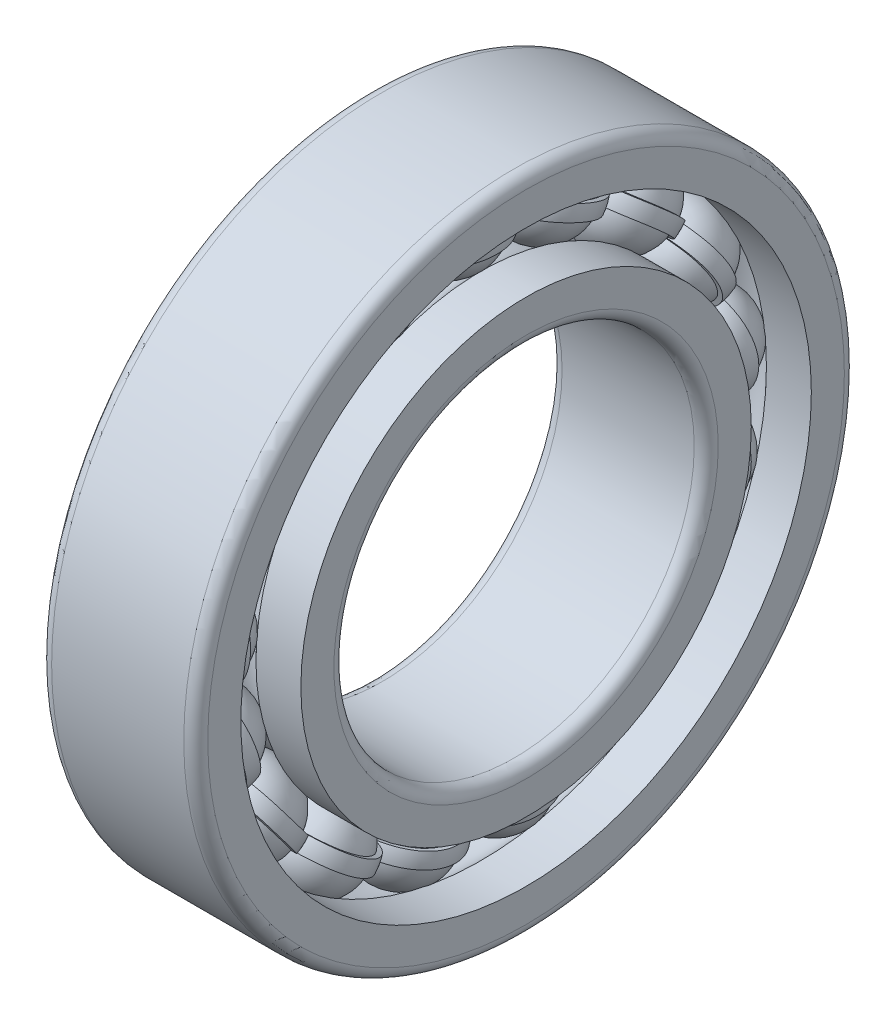
from build123d import *

# Parameters (mm, degrees)
CAGSPISKE_W          = 0.75
CAGSPISKE_H          = 1.25
CAGEBALLS_COUNT      = 17
CAGEBALLS_ANGLE      = 338.823529412
CAGTRMODSKE_W        = 8.252
CAGTRMODSKE_H        = 3.501
CAGETRIMID_START     = -4.077376728
CAGETRIMID_OUTLINE_R = 20.625
CAGETRIMID_DEPTH     = 8.154753456
CIRPATTERN4_COUNT    = 17


with BuildPart() as part:
    # CagSpiSke → CageSpine (revolve)
    with BuildSketch(Plane.XY, mode=Mode.PRIVATE) as cagespine_sk:
        with Locations((0, 21.25)):
            Rectangle(CAGSPISKE_W, CAGSPISKE_H)
    revolve(cagespine_sk.sketch.rotate(Axis((-20.6375, 0, 0), (1, 0, 0)), 270), axis=Axis((-20.6375, 0, 0), (1, 0, 0)))

    # CagBalSke → CageBall (revolve)
    with BuildSketch(Plane.XY):
        with BuildLine():
            Line((-4.125, 21.25), (4.125, 21.25))
            ThreePointArc((4.125, 21.25), (0, 17.125), (-4.125, 21.25))
        make_face()
    cageball = revolve(axis=Axis((-1.905, 21.25, 0), (1, 0, 0)))

    # CageBalls: CageBall ×17 about axis
    cageballs_axis = Axis((-50, 0, 0), (1, 0, 0))
    for i in range(1, CAGEBALLS_COUNT):
        add(cageball.rotate(cageballs_axis, i * CAGEBALLS_ANGLE / (CAGEBALLS_COUNT - 1)))

    # CagTrmODSke → CageTrimOD (revolve, cut)
    with BuildSketch(Plane.XY, mode=Mode.PRIVATE) as cagetrimod_sk:
        with Locations((0, 23.6255)):
            Rectangle(CAGTRMODSKE_W, CAGTRMODSKE_H)
    revolve(cagetrimod_sk.sketch.rotate(Axis((-20.6375, 0, 0), (1, 0, 0)), 264.705881367), axis=Axis((-20.6375, 0, 0), (1, 0, 0)), mode=Mode.SUBTRACT)

    # CageTrimID: read off the stored shape, not the designer's step
    # CageTrimID outline → CageTrimID (cut)
    with BuildSketch(Plane.YZ.offset(CAGETRIMID_START)):
        Circle(CAGETRIMID_OUTLINE_R)
    extrude(amount=CAGETRIMID_DEPTH, mode=Mode.SUBTRACT)


with BuildPart() as body_2:
    # BalDetSke → BallDetailed (revolve)
    with BuildSketch(Plane.XY):
        with BuildLine():
            Line((-3.75, 21.25), (3.75, 21.25))
            ThreePointArc((3.75, 21.25), (0, 17.5), (-3.75, 21.25))
        make_face()
    revolve(axis=Axis((-1.905, 21.25, 0), (1, 0, 0)))


with BuildPart() as body_3:
    # InnRacSke → InnerRace (revolve)
    with BuildSketch(Plane.XY, mode=Mode.PRIVATE) as innerrace_sk:
        with BuildLine():
            Line((-2.761453422, 18.75), (-6.5, 18.75))
            Line((-6.5, 18.75), (-6.5, 16))
            ThreePointArc((-6.5, 16), (-6.207106781, 15.292893219), (-5.5, 15))
            Line((-5.5, 15), (5.5, 15))
            ThreePointArc((5.5, 15), (6.207106781, 15.292893219), (6.5, 16))
            Line((6.5, 16), (6.5, 18.75))
            Line((6.5, 18.75), (2.761453422, 18.75))
            ThreePointArc((2.761453422, 18.75), (0, 17.525), (-2.761453422, 18.75))
        make_face()
    revolve(innerrace_sk.sketch.rotate(Axis((-20.6375, 0, 0), (1, 0, 0)), 270), axis=Axis((-20.6375, 0, 0), (1, 0, 0)))


with BuildPart() as body_4:
    # OutRacSke → OuterRace (revolve)
    with BuildSketch(Plane.XY, mode=Mode.PRIVATE) as outerrace_sk:
        with BuildLine():
            Line((-2.761453422, 23.75), (-6.5, 23.75))
            Line((-6.5, 23.75), (-6.5, 26.5))
            ThreePointArc((-6.5, 26.5), (-6.207106781, 27.207106781), (-5.5, 27.5))
            Line((-5.5, 27.5), (5.5, 27.5))
            ThreePointArc((5.5, 27.5), (6.207106781, 27.207106781), (6.5, 26.5))
            Line((6.5, 26.5), (6.5, 23.75))
            Line((6.5, 23.75), (2.761453422, 23.75))
            ThreePointArc((2.761453422, 23.75), (0, 24.975), (-2.761453422, 23.75))
        make_face()
    revolve(outerrace_sk.sketch.rotate(Axis((-20.6375, 0, 0), (1, 0, 0)), 270), axis=Axis((-20.6375, 0, 0), (1, 0, 0)))


with BuildPart() as cirpattern4_1:
    # CirPattern4: pattern copy
    add(body_2.part.rotate(Axis((0, 0, 0), (1, 0, 0)), 1 * 360 / CIRPATTERN4_COUNT))


with BuildPart() as cirpattern4_2:
    # CirPattern4: pattern copy
    add(body_2.part.rotate(Axis((0, 0, 0), (1, 0, 0)), 2 * 360 / CIRPATTERN4_COUNT))


with BuildPart() as cirpattern4_3:
    # CirPattern4: pattern copy
    add(body_2.part.rotate(Axis((0, 0, 0), (1, 0, 0)), 3 * 360 / CIRPATTERN4_COUNT))


with BuildPart() as cirpattern4_4:
    # CirPattern4: pattern copy
    add(body_2.part.rotate(Axis((0, 0, 0), (1, 0, 0)), 4 * 360 / CIRPATTERN4_COUNT))


with BuildPart() as cirpattern4_5:
    # CirPattern4: pattern copy
    add(body_2.part.rotate(Axis((0, 0, 0), (1, 0, 0)), 5 * 360 / CIRPATTERN4_COUNT))


with BuildPart() as cirpattern4_6:
    # CirPattern4: pattern copy
    add(body_2.part.rotate(Axis((0, 0, 0), (1, 0, 0)), 6 * 360 / CIRPATTERN4_COUNT))


with BuildPart() as cirpattern4_7:
    # CirPattern4: pattern copy
    add(body_2.part.rotate(Axis((0, 0, 0), (1, 0, 0)), 7 * 360 / CIRPATTERN4_COUNT))


with BuildPart() as cirpattern4_8:
    # CirPattern4: pattern copy
    add(body_2.part.rotate(Axis((0, 0, 0), (1, 0, 0)), 8 * 360 / CIRPATTERN4_COUNT))


with BuildPart() as cirpattern4_9:
    # CirPattern4: pattern copy
    add(body_2.part.rotate(Axis((0, 0, 0), (1, 0, 0)), 9 * 360 / CIRPATTERN4_COUNT))


with BuildPart() as cirpattern4_10:
    # CirPattern4: pattern copy
    add(body_2.part.rotate(Axis((0, 0, 0), (1, 0, 0)), 10 * 360 / CIRPATTERN4_COUNT))


with BuildPart() as cirpattern4_11:
    # CirPattern4: pattern copy
    add(body_2.part.rotate(Axis((0, 0, 0), (1, 0, 0)), 11 * 360 / CIRPATTERN4_COUNT))


with BuildPart() as cirpattern4_12:
    # CirPattern4: pattern copy
    add(body_2.part.rotate(Axis((0, 0, 0), (1, 0, 0)), 12 * 360 / CIRPATTERN4_COUNT))


with BuildPart() as cirpattern4_13:
    # CirPattern4: pattern copy
    add(body_2.part.rotate(Axis((0, 0, 0), (1, 0, 0)), 13 * 360 / CIRPATTERN4_COUNT))


with BuildPart() as cirpattern4_14:
    # CirPattern4: pattern copy
    add(body_2.part.rotate(Axis((0, 0, 0), (1, 0, 0)), 14 * 360 / CIRPATTERN4_COUNT))


with BuildPart() as cirpattern4_15:
    # CirPattern4: pattern copy
    add(body_2.part.rotate(Axis((0, 0, 0), (1, 0, 0)), 15 * 360 / CIRPATTERN4_COUNT))


with BuildPart() as cirpattern4_16:
    # CirPattern4: pattern copy
    add(body_2.part.rotate(Axis((0, 0, 0), (1, 0, 0)), 16 * 360 / CIRPATTERN4_COUNT))


solid = Compound([part.part, body_2.part, body_3.part, body_4.part, cirpattern4_1.part, cirpattern4_2.part, cirpattern4_3.part, cirpattern4_4.part, cirpattern4_5.part, cirpattern4_6.part, cirpattern4_7.part, cirpattern4_8.part, cirpattern4_9.part, cirpattern4_10.part, cirpattern4_11.part, cirpattern4_12.part, cirpattern4_13.part, cirpattern4_14.part, cirpattern4_15.part, cirpattern4_16.part])
